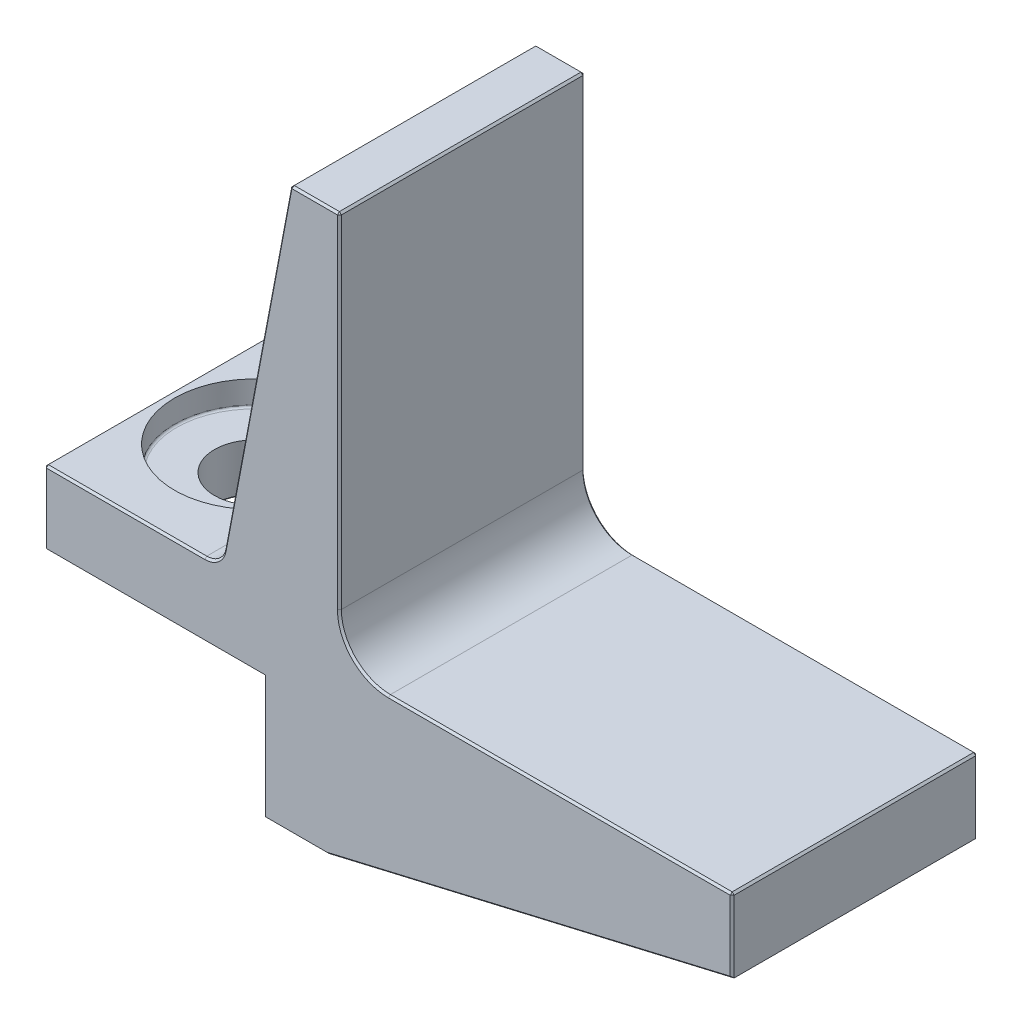
from build123d import *
from OCP.BRepFilletAPI import BRepFilletAPI_MakeChamfer

# Parameters (mm, degrees)
BOSS_EXTRUDE1_DEPTH                                  = 31.75
CBORE_FOR_3_8_BINDING_HEAD_MACHINE_SCREW_D           = 10.3378
CBORE_FOR_3_8_BINDING_HEAD_MACHINE_SCREW_CBORE_D     = 20.6756
CBORE_FOR_3_8_BINDING_HEAD_MACHINE_SCREW_CBORE_DEPTH = 3.175
FILLET1_R                                            = 2.54
FILLET2_R                                            = 6.35
CHAMFER1_SIZE                                        = 0.254
CHAMFER1_SIZE2                                       = 0.319077958
FILLET3_R                                            = 0.254
CHAMFER2_SIZE                                        = 0.254


with BuildPart() as part:
    # Sketch1 → Boss-Extrude1 (new body)
    with BuildSketch(Plane.XY):
        Polygon((0, 0), (50.8, 0), (50.8, -9.525), (-1.5848076, -21.771101892), (-9.8398076, -21.771101892), (-9.8398076, -5.896101892), (-38.1608076, -5.896101892), (-38.1608076, 3.628898108), (-15.3008076, 3.628898108), (-6.35, 50.8), (0, 50.8), align=None)
    extrude(amount=BOSS_EXTRUDE1_DEPTH)

    # CBORE for 3/8 Binding Head Machine Screw1 (through all)
    with Locations(Plane(origin=(0, 3.628898108, 0), x_dir=(1, 0, 0), z_dir=(0, 1, 0))):
        with Locations((-26.8578076, -15.875)):
            CounterBoreHole(CBORE_FOR_3_8_BINDING_HEAD_MACHINE_SCREW_D / 2, CBORE_FOR_3_8_BINDING_HEAD_MACHINE_SCREW_CBORE_D / 2, CBORE_FOR_3_8_BINDING_HEAD_MACHINE_SCREW_CBORE_DEPTH)

    # Fillet1
    fillet1_edges = [part.edges().sort_by_distance(p)[0] for p in [
        (-15.3008076, 3.628898108, 15.875),
    ]]
    fillet(fillet1_edges, radius=FILLET1_R)

    # Fillet2
    fillet2_edges = [part.edges().sort_by_distance(p)[0] for p in [
        (0, 0, 15.875),
    ]]
    fillet(fillet2_edges, radius=FILLET2_R)

    # Chamfer1: one chamfer whose edges measure the first distance from different faces: ONE call of the kernel's chamfer builder (chamfer() names one face for all edges)
    chamfer1_edges_1 = [part.edges().sort_by_distance(p)[0] for p in [
        (-6.35, 50.8, 15.875),
    ]]
    chamfer1_side_1 = [part.faces().sort_by_distance(p)[0] for p in [
        (-3.175, 50.8, 15.875),
    ]]
    chamfer1_edges_2 = [part.edges().sort_by_distance(p)[0] for p in [
        (-3.175, 50.8, 0),
        (-3.175, 50.8, 31.75),
        (0, 50.8, 15.875),
        (-10.629344568, 28.247688782, 0),
        (-10.629344568, 28.247688782, 31.75),
        (-15.784151771, 4.212582415, 0),
        (-27.782484147, 3.628898108, 0),
        (-38.1608076, 3.628898108, 15.875),
        (-27.782484147, 3.628898108, 31.75),
        (-38.1608076, -1.133601892, 0),
        (-38.1608076, -5.896101892, 15.875),
        (-38.1608076, -1.133601892, 31.75),
        (-24.0003076, -5.896101892, 0),
        (-24.0003076, -5.896101892, 31.75),
        (50.8, -4.7625, 0),
        (50.8, -4.7625, 31.75),
        (50.8, 0, 15.875),
        (28.575, 0, 0),
        (1.859871939, 1.859871939, 0),
        (1.859871939, 1.859871939, 31.75),
        (0, 28.575, 0),
        (0, 28.575, 31.75),
        (-15.784151771, 4.212582415, 31.75),
        (28.575, 0, 31.75),
        (-9.8398076, -13.833601892, 0),
        (-9.8398076, -13.833601892, 31.75),
        (-5.7123076, -21.771101892, 0),
        (-5.7123076, -21.771101892, 31.75),
        (24.6075962, -15.648050946, 0),
        (24.6075962, -15.648050946, 31.75),
    ]]
    chamfer1 = BRepFilletAPI_MakeChamfer(part.part.solid().wrapped)
    for e in chamfer1_edges_1:
        chamfer1.Add(CHAMFER1_SIZE, CHAMFER1_SIZE2, e.wrapped, chamfer1_side_1[0].wrapped)  # the first distance lies on this face
    for e in chamfer1_edges_2:
        chamfer1.Add(CHAMFER1_SIZE, e.wrapped)
    add(Compound.cast(chamfer1.Shape()), mode=Mode.REPLACE)

    # Fillet3
    fillet3_edges = [part.edges().sort_by_distance(p)[0] for p in [
        (-37.1956076, 0.453898108, 15.875),
    ]]
    fillet(fillet3_edges, radius=FILLET3_R)

    # Chamfer2
    chamfer2_edges = [part.edges().sort_by_distance(p)[0] for p in [
        (-21.6889076, -5.896101892, 15.875),
    ]]
    chamfer(chamfer2_edges, length=CHAMFER2_SIZE)


solid = part.part
